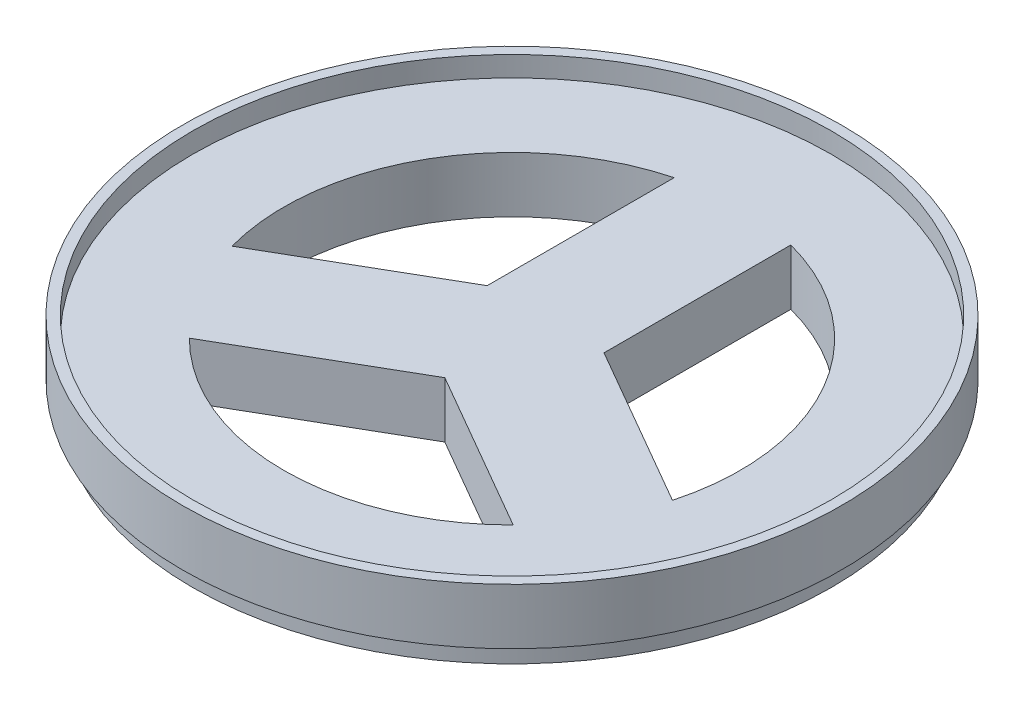
from build123d import *

# Parameters (mm, degrees)
SZKIC1_R                    = 65
DODANIE_WYCI_GNI_CIE1_DEPTH = 11
SZKIC3_R                    = 65
SZKIC3_R_2                  = 63
DODANIE_WYCI_GNI_CIE2_DEPTH = 4
SZKIC6_R                    = 65
SZKIC6_R_2                  = 63
WYTNIJ_WYCI_GNI_CIE1_DEPTH  = 4


with BuildPart() as part:
    # Szkic1 → Dodanie-wyciągnięcie1 (new body)
    with BuildSketch(Plane(origin=(0, 0, 0), x_dir=(1, 0, 0), z_dir=(0, 1, 0))):
        Circle(SZKIC1_R)
        with BuildLine():
            Line((-31.916956587, -31.722356189), (0.027776069, -13.279056191))
            Line((0.027776069, -13.279056191), (31.937203092, -31.701972473))
            ThreePointArc((31.937203092, -31.701972473), (0.014365034, -44.999997707), (-31.916956587, -31.722356189))
        make_face(mode=Mode.SUBTRACT)
        with BuildLine():
            Line((-11.513888034, 6.615473315), (-43.423315058, -11.807442967))
            ThreePointArc((-43.423315058, -11.807442967), (-38.978323702, 22.487558369), (-11.513888034, 43.502073311))
            Line((-11.513888034, 43.502073311), (-11.513888034, 6.615473315))
        make_face(mode=Mode.SUBTRACT)
        with BuildLine():
            Line((11.486111966, 6.663582877), (11.486111966, 43.50941544))
            ThreePointArc((11.486111966, 43.50941544), (38.963958668, 22.512439338), (43.430844622, -11.779717121))
            Line((43.430844622, -11.779717121), (11.486111966, 6.663582877))
        make_face(mode=Mode.SUBTRACT)
    extrude(amount=DODANIE_WYCI_GNI_CIE1_DEPTH)

    # Szkic3 → Dodanie-wyciągnięcie2 (add)
    with BuildSketch(Plane(origin=(0, 11, 0), x_dir=(1, 0, 0), z_dir=(0, 1, 0))):
        Circle(SZKIC3_R)
        Circle(SZKIC3_R_2, mode=Mode.SUBTRACT)
    extrude(amount=DODANIE_WYCI_GNI_CIE2_DEPTH)

    # Szkic6 → Wytnij-wyciągnięcie1 (cut)
    with BuildSketch(Plane.XZ):
        Circle(SZKIC6_R)
        Circle(SZKIC6_R_2, mode=Mode.SUBTRACT)
    extrude(amount=-WYTNIJ_WYCI_GNI_CIE1_DEPTH, mode=Mode.SUBTRACT)


solid = part.part
